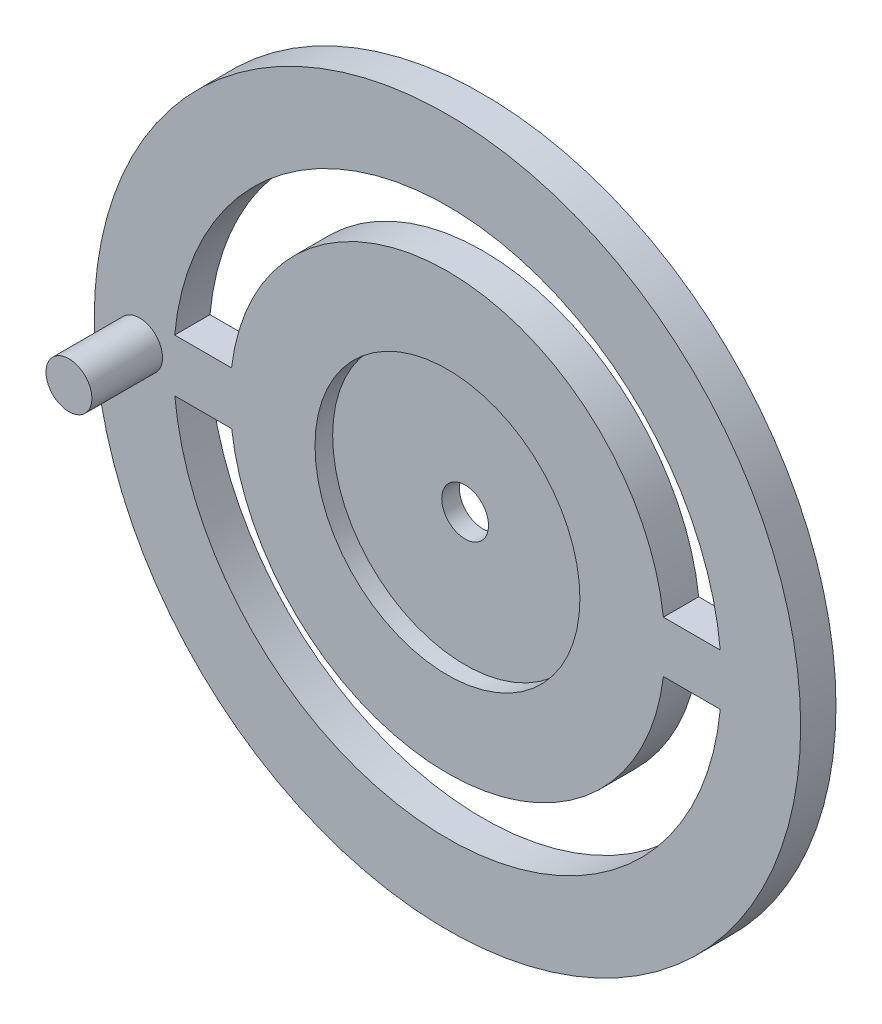
from build123d import *

# Parameters (mm, degrees)
SKETCH1_R           = 40
SKETCH1_R_2         = 2.65
BOSS_EXTRUDE1_DEPTH = 4
SKETCH2_R           = 2.6
BOSS_EXTRUDE2_DEPTH = 8
CUT_EXTRUDE2_START  = -2
SKETCH3_R           = 15
CUT_EXTRUDE2_DEPTH  = 10


with BuildPart() as part:
    # Sketch1 → Boss-Extrude1 (new body)
    with BuildSketch(Plane.XY):
        with Locations((663.219031186, -1255.036738659)):
            Circle(SKETCH1_R)
        with Locations((663.219031186, -1255.036738659)):
            Circle(SKETCH1_R_2, mode=Mode.SUBTRACT)
        with BuildLine():
            Line((638.767195658, -1252.128812685), (632.327252406, -1252.128812685))
            ThreePointArc((632.327252406, -1252.128812685), (663.219031186, -1224.008396299), (694.110809965, -1252.128812685))
            Line((694.110809965, -1252.128812685), (687.670866713, -1252.128812685))
            ThreePointArc((687.670866713, -1252.128812685), (663.219031186, -1230.412598184), (638.767195658, -1252.128812685))
        make_face(mode=Mode.SUBTRACT)
        with BuildLine():
            Line((638.784280521, -1258.084894509), (632.340608044, -1258.08321431))
            ThreePointArc((632.340608044, -1258.08321431), (663.288627138, -1286.065002968), (694.110809965, -1257.944664633))
            Line((694.110809965, -1257.944664633), (687.670866713, -1257.944664633))
            ThreePointArc((687.670866713, -1257.944664633), (663.289664589, -1279.66077783), (638.784280521, -1258.084894509))
        make_face(mode=Mode.SUBTRACT)
    extrude(amount=BOSS_EXTRUDE1_DEPTH)

    # Sketch2 → Boss-Extrude2 (add)
    with BuildSketch(Plane.XY.offset(4)):
        with Locations((628.352103933, -1255.036738659)):
            Circle(SKETCH2_R)
    extrude(amount=BOSS_EXTRUDE2_DEPTH)

    # Sketch3 → Cut-Extrude2 (cut)
    with BuildSketch(Plane(origin=(0, 0, 0), x_dir=(-1, 0, 0), z_dir=(0, 0, -1)).offset(CUT_EXTRUDE2_START)):
        with Locations((-663.219031186, -1255.036738659)):
            Circle(SKETCH3_R)
    extrude(amount=-CUT_EXTRUDE2_DEPTH, mode=Mode.SUBTRACT)


solid = part.part
